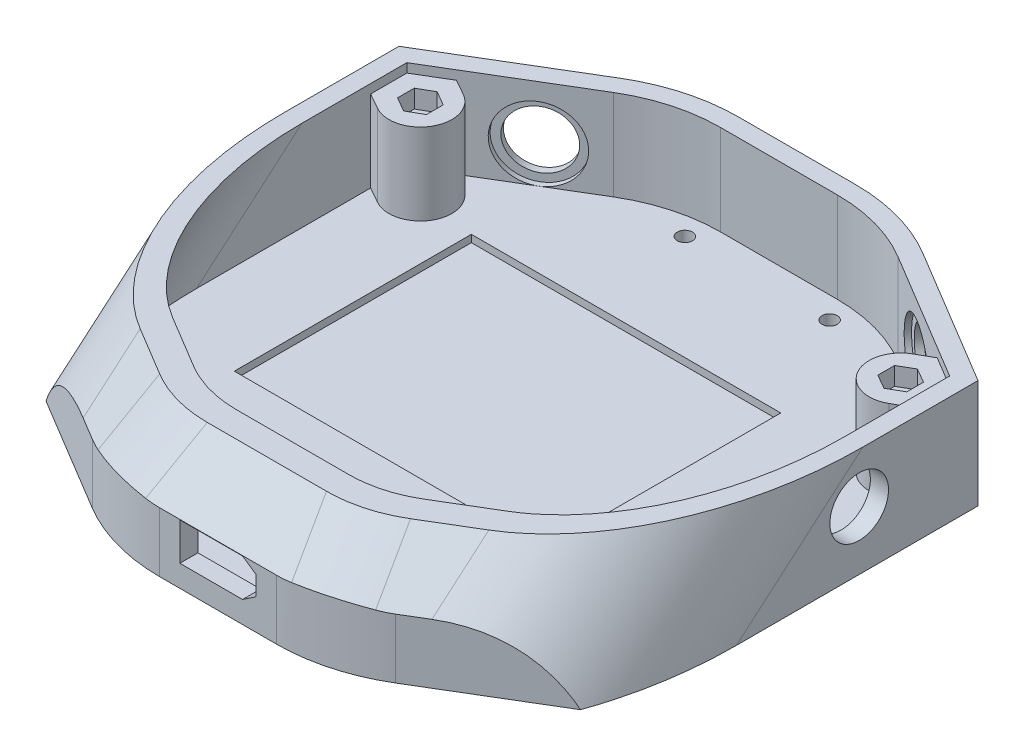
from build123d import *

# Parameters (mm, degrees)
BOSS_EXTRUDE1_DEPTH = 30
CHAMFER1_SIZE       = 13.5
FILLET1_R           = 50
FILLET2_R           = 50
SHELL1_T            = -5
CUT_EXTRUDE1_REACH  = 183.384
SKETCH5_W           = 85.5
SKETCH5_H           = 65.5
CUT_EXTRUDE2_DEPTH  = 2
SKETCH6_R           = 10.1203125
CUT_EXTRUDE3_DEPTH  = 1.488
CUT_EXTRUDE4_START  = -1.488
SKETCH7_R           = 10.1203125
CUT_EXTRUDE4_DEPTH  = 1.488
CUT_EXTRUDE5_REACH  = 198.109
SKETCH8_R           = 7.9375
BOSS_EXTRUDE2_START = -25
BOSS_EXTRUDE2_DEPTH = 22.5
CUT_EXTRUDE6_START  = -2.5
CUT_EXTRUDE6_DEPTH  = 5
SKETCH11_R          = 2.1
CUT_EXTRUDE7_DEPTH  = 155.677082983
CUT_EXTRUDE8_REACH  = 210.327
SKETCH12_R          = 8.1


with BuildPart() as part:
    # Sketch3 → Boss-Extrude1 (new body)
    with BuildSketch(Plane(origin=(0, 0, 0), x_dir=(1, 0, 0), z_dir=(0, 1, 0))):
        Polygon((80, 0), (80, -100), (30, -130), (-30, -130), (-80, -100), (-80, 0), (-30, 30), (30, 30), align=None)
    extrude(amount=BOSS_EXTRUDE1_DEPTH)

    # Chamfer1
    chamfer1_edges = [part.edges().sort_by_distance(p)[0] for p in [
        (-55, 30, 115),
        (0, 30, 130),
        (55, 30, 115),
    ]]
    chamfer(chamfer1_edges, length=CHAMFER1_SIZE)

    # Fillet1
    # the kernel refuses this fillet: 50 mm, written as the material it takes off along each edge
    with BuildSketch(Plane(origin=(30, -34.622995619, 130), x_dir=(0.857492925712544, 0, -0.5144957554275268), z_dir=(0, 1, 0)), Plane(origin=(-30, -34.622995619, 130), x_dir=(1, 0, 0), z_dir=(0, 1, 0))) as fillet1_piece_1:
        with BuildLine():
            CenterArc((FILLET1_R * 0.276983964948, FILLET1_R), FILLET1_R, 239.036243468, 30.963756532)
            Line((-FILLET1_R * 0.237511790479, FILLET1_R * 0.142507074287), (0, 0))
            Line((0, 0), (FILLET1_R * 0.276983964948, 0))
        make_face()
    extrude(amount=85.745991237, mode=Mode.SUBTRACT)
    with BuildSketch(Plane(origin=(-80, -39.074271729, 164.810181009), x_dir=(0, -0.759125277171481, -0.6509445549041194), z_dir=(0, 0.6509445549041194, -0.759125277171481))) as fillet1_piece_2:
        with BuildLine():
            CenterArc((FILLET1_R * 0.682998529574, -FILLET1_R), FILLET1_R, 90, 68.666037253)
            Line((-FILLET1_R * 0.248477212904, -FILLET1_R * 0.636196562446), (0, 0))
            Line((0, 0), (FILLET1_R * 0.682998529574, 0))
        make_face()
    extrude(amount=191.488725913, mode=Mode.SUBTRACT)
    with BuildSketch(Plane(origin=(80, -39.074271729, 164.810181009), x_dir=(0, -0.759125277171481, -0.6509445549041195), z_dir=(0, 0.6509445549041195, -0.759125277171481))) as fillet1_piece_3:
        with BuildLine():
            CenterArc((FILLET1_R * 0.682998529574, FILLET1_R), FILLET1_R, 201.333962747, 68.666037253)
            Line((-FILLET1_R * 0.248477212904, FILLET1_R * 0.636196562446), (0, 0))
            Line((0, 0), (FILLET1_R * 0.682998529574, 0))
        make_face()
    extrude(amount=191.488725913, mode=Mode.SUBTRACT)
    with BuildSketch(Plane(origin=(34.617865704, -0.171960433, 146.671960433), x_dir=(0.9114297192816029, -0.13590975982943138, -0.3883611772478869), z_dir=(-0.19220542560964893, 0.6939225729021263, -0.6939225729021263)), Plane(origin=(-34.617865704, -0.171960433, 146.671960433), x_dir=(0.9813547138350198, -0.13590975982942916, 0.13590975982942954), z_dir=(0.19220542560964907, 0.6939225729021263, -0.6939225729021263))) as fillet1_piece_4:
        with BuildLine():
            CenterArc((FILLET1_R * 0.19220542561, FILLET1_R), FILLET1_R, 248.24024707, 21.75975293)
            Line((-FILLET1_R * 0.178510109177, FILLET1_R * 0.0712535371437), (0, 0))
            Line((0, 0), (FILLET1_R * 0.19220542561, 0))
        make_face()
    extrude(amount=67.505976453, mode=Mode.SUBTRACT)

    # Fillet2
    fillet2_edges = [part.edges().sort_by_distance(p)[0] for p in [
        (30, 15, -30),
        (-30, 15, -30),
    ]]
    fillet(fillet2_edges, radius=FILLET2_R)

    # Shell1
    shell1_openings = [part.faces().sort_by_distance(p)[0] for p in [
        (0, 30, 41.507073617),
    ]]
    offset(amount=SHELL1_T, openings=shell1_openings)

    # Sketch4 → Cut-Extrude1 (cut, up to next)
    with BuildSketch(Plane.XY.offset(130), mode=Mode.PRIVATE) as cut_extrude1_sk1:
        Polygon((10.55, 13.832263561), (10.55, 8.567736439), (6.776999518, 6), (-10.55, 6), (-10.55, 16.4), (6.776999518, 16.4), align=None)
    cut_extrude1_tool1 = extrude(cut_extrude1_sk1.sketch, amount=-CUT_EXTRUDE1_REACH, mode=Mode.PRIVATE) & part.part
    add(cut_extrude1_tool1.solids().sort_by_distance((-0.429196, 11.2, 130))[0], mode=Mode.SUBTRACT)

    # Sketch5 → Cut-Extrude2 (cut)
    with BuildSketch(Plane(origin=(0, 5, 0), x_dir=(1, 0, 0), z_dir=(0, 1, 0))):
        with Locations((-7.25, -42.75)):
            Rectangle(SKETCH5_W, SKETCH5_H)
    extrude(amount=-CUT_EXTRUDE2_DEPTH, mode=Mode.SUBTRACT)

    # Sketch6 → Cut-Extrude3 (cut)
    with BuildSketch(Plane(origin=(21.176470588, 0, -35.294117647), x_dir=(-0.8574929257125442, 0, -0.5144957554275265), z_dir=(0.5144957554275265, 0, -0.8574929257125442))):
        with Locations((-39.259425856, 15.1203125)):
            Circle(SKETCH6_R)
    cut_extrude3 = extrude(amount=-CUT_EXTRUDE3_DEPTH, mode=Mode.SUBTRACT)

    # Sketch7 → Cut-Extrude4 (cut)
    with BuildSketch(Plane(origin=(18.603991811, 0, -31.006653018), x_dir=(0.8574929257125442, 0, 0.5144957554275265), z_dir=(-0.5144957554275265, 0, 0.8574929257125442)).offset(CUT_EXTRUDE4_START)):
        with Locations(Location((39.259425856, 15.1203125, 0), (0, 0, 180))):
            Circle(SKETCH7_R)
    cut_extrude4 = extrude(amount=CUT_EXTRUDE4_DEPTH, mode=Mode.SUBTRACT)

    # Sketch8 → Cut-Extrude5 (cut, up to next)
    with BuildSketch(Plane(origin=(21.176470588, 0, -35.294117647), x_dir=(-0.8574929257125442, 0, -0.5144957554275265), z_dir=(0.5144957554275265, 0, -0.8574929257125442)), mode=Mode.PRIVATE) as cut_extrude5_sk1:
        with Locations((-39.259425856, 15.1203125)):
            Circle(SKETCH8_R)
    cut_extrude5_tool1 = extrude(cut_extrude5_sk1.sketch, amount=-CUT_EXTRUDE5_REACH, mode=Mode.PRIVATE) & part.part
    cut_extrude5 = cut_extrude5_tool1.solids().sort_by_distance((54.841151, 15.120313, -15.09531))[0]
    add(cut_extrude5, mode=Mode.SUBTRACT)

    # Mirror1: Cut-Extrude3, Cut-Extrude4, Cut-Extrude5 across plane
    add(cut_extrude3.mirror(Plane(origin=(0, 0, 0), x_dir=(0, 0, 1), z_dir=(1, 0, 0))), mode=Mode.SUBTRACT)
    add(cut_extrude4.mirror(Plane(origin=(0, 0, 0), x_dir=(0, 0, 1), z_dir=(1, 0, 0))), mode=Mode.SUBTRACT)
    add(cut_extrude5.mirror(Plane(origin=(0, 0, 0), x_dir=(0, 0, 1), z_dir=(1, 0, 0))), mode=Mode.SUBTRACT)

    # Sketch9 → Boss-Extrude2 (add)
    with BuildSketch(Plane(origin=(0, 30, 0), x_dir=(1, 0, 0), z_dir=(0, 1, 0)).offset(BOSS_EXTRUDE2_START)):
        with BuildLine():
            Line((-75, -2.830951895), (-66.425070743, 2.314005659))
            Line((-66.425070743, 2.314005659), (-62.074071209, -0.149488415))
            ThreePointArc((-62.074071209, -0.149488415), (-58.789057061, -12.009431821), (-70.649000466, -15.29444597))
            Line((-70.649000466, -15.29444597), (-75, -12.830951895))
            Line((-75, -12.830951895), (-75, -2.830951895))
        make_face()
    boss_extrude2 = extrude(amount=BOSS_EXTRUDE2_DEPTH)

    # Sketch10 → Cut-Extrude6 (cut)
    with BuildSketch(Plane(origin=(0, 30, 0), x_dir=(1, 0, 0), z_dir=(0, 1, 0)).offset(CUT_EXTRUDE6_START)):
        Polygon((-62.361535838, -5.412566116), (-66.361535838, -3.103165039), (-70.361535838, -5.412566116), (-70.361535838, -10.031368269), (-66.361535838, -12.340769346), (-62.361535838, -10.031368269), align=None)
    cut_extrude6 = extrude(amount=-CUT_EXTRUDE6_DEPTH, mode=Mode.SUBTRACT)

    # Mirror2: Boss-Extrude2, Cut-Extrude6 across plane
    add(boss_extrude2.mirror(Plane(origin=(0, 0, 0), x_dir=(0, 0, 1), z_dir=(1, 0, 0))))
    add(cut_extrude6.mirror(Plane(origin=(0, 0, 0), x_dir=(0, 0, 1), z_dir=(1, 0, 0))), mode=Mode.SUBTRACT)

    # Sketch11 → Cut-Extrude7 (cut, through all)
    with BuildSketch(Plane(origin=(0, 5, 0), x_dir=(1, 0, 0), z_dir=(0, 1, 0))):
        with Locations(Location((-27.25, -95.5, 0), (0, 0, 270))):
            Circle(SKETCH11_R)
        with Locations(Location((-20, 19, 0), (0, 0, 270))):
            Circle(SKETCH11_R)
    cut_extrude7 = extrude(amount=-CUT_EXTRUDE7_DEPTH, mode=Mode.SUBTRACT)

    # Mirror3: Cut-Extrude7 across plane
    add(cut_extrude7.mirror(Plane(origin=(0, 0, 0), x_dir=(0, 0, 1), z_dir=(1, 0, 0))), mode=Mode.SUBTRACT)

    # Sketch12 → Cut-Extrude8 (cut, up to next)
    with BuildSketch(Plane(origin=(80, 0, 0), x_dir=(0, 0, -1), z_dir=(1, 0, 0)), mode=Mode.PRIVATE) as cut_extrude8_sk1:
        with Locations((-32.830951895, 16.25)):
            Circle(SKETCH12_R)
    cut_extrude8_tool1 = extrude(cut_extrude8_sk1.sketch, amount=-CUT_EXTRUDE8_REACH, mode=Mode.PRIVATE) & part.part
    add(cut_extrude8_tool1.solids().sort_by_distance((80, 16.25, 32.830952))[0], mode=Mode.SUBTRACT)


solid = part.part
